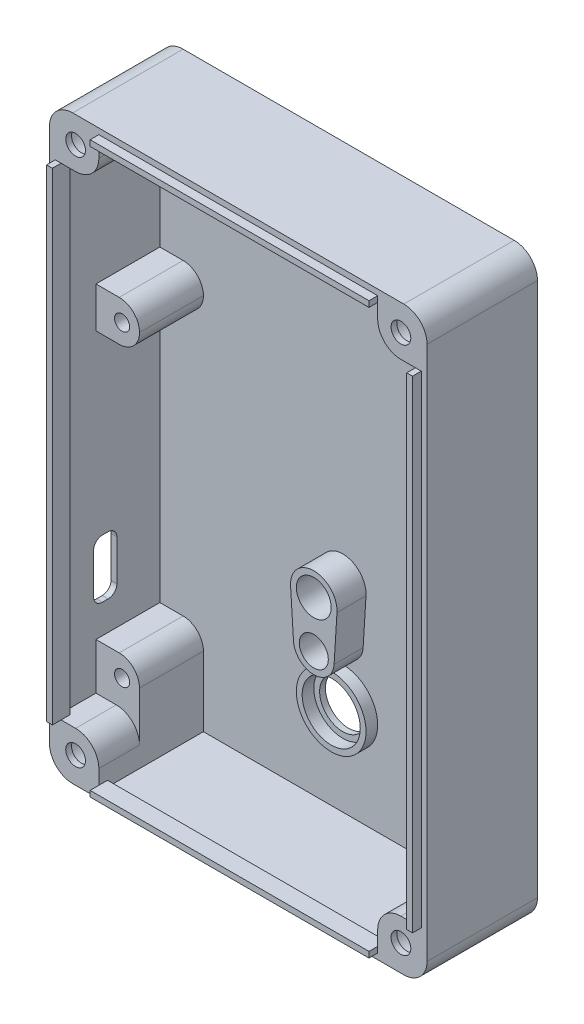
from build123d import *

# Parameters (mm, degrees)
SKETCH_1_W            = 65
SKETCH_1_H            = 100
SKETCH_1_W_2          = 63
SKETCH_1_H_2          = 98
EXTRUDE_1_DEPTH       = 18
SKETCH_3_W            = 65
SKETCH_3_H            = 100
EXTRUDE_2_DEPTH       = 1
SKETCH_4_W            = 7.5
SKETCH_4_H            = 7
SKETCH_4_H_2          = 8
EXTRUDE_3_DEPTH       = 11
SKETCH_8_W            = 7.5
SKETCH_8_H            = 7.5
EXTRUDE_4_DEPTH       = 18
EXTRUDE_10_DEPTH      = 1.5
EXTRUDE_10_DEPTH_BACK = 1.5
SKETCH_17_W           = 48
SKETCH_17_H           = 1
SKETCH_17_W_2         = 1
SKETCH_17_H_2         = 83
SKETCH_11_R           = 3
CUT_EXTRUDE_2_DEPTH   = 18
HOLE_WIZARD_M31_D     = 3.4
SKETCH_5_R            = 1.3
CUT_EXTRUDE_4_DEPTH   = 5
SKETCH_15_W           = 4
SKETCH_15_H           = 10
CUT_EXTRUDE_3_DEPTH   = 1
FILLET_5_R            = 1.5
FILLET_6_R            = 3.5
FILLET_7_R            = 4
SKETCH_16_R           = 6
SKETCH_16_R_2         = 5
EXTRUDE_6_DEPTH       = 2
SKETCH_10_6_R         = 3
SKETCH_10_6_R_2       = 2.5
EXTRUDE_8_DEPTH       = 5
SKETCH_9_4_R          = 4
SKETCH_9_4_R_2        = 2.5
SKETCH_9_4_R_3        = 3
CUT_EXTRUDE_6_DEPTH   = 63.741533293
FILLET_8_R            = 4


with BuildPart() as part:
    # Эскиз1 → Бобышка-Вытянуть1 (new body)
    with BuildSketch(Plane.XY):
        Rectangle(SKETCH_1_W, SKETCH_1_H)
        Rectangle(SKETCH_1_W_2, SKETCH_1_H_2, mode=Mode.SUBTRACT)
    extrude(amount=EXTRUDE_1_DEPTH)

    # Эскиз3 → Бобышка-Вытянуть2 (add)
    with BuildSketch(Plane(origin=(0, 0, 0), x_dir=(-1, 0, 0), z_dir=(0, 0, -1))):
        Rectangle(SKETCH_3_W, SKETCH_3_H)
    extrude(amount=EXTRUDE_2_DEPTH)

    # Эскиз4 → Бобышка-Вытянуть3 (add)
    with BuildSketch(Plane.XY):
        with Locations((-27.75, 16)):
            Rectangle(SKETCH_4_W, SKETCH_4_H)
        with Locations((27.75, 16)):
            Rectangle(SKETCH_4_W, SKETCH_4_H)
        with Locations((-27.75, -37.5)):
            Rectangle(SKETCH_4_W, SKETCH_4_H_2)
        with Locations((27.75, -37.5)):
            Rectangle(SKETCH_4_W, SKETCH_4_H_2)
    extrude(amount=EXTRUDE_3_DEPTH)

    # Эскиз8 → Бобышка-Вытянуть4 (add)
    with BuildSketch(Plane.XY):
        with Locations((-27.75, 45.25)):
            Rectangle(SKETCH_8_W, SKETCH_8_H)
        with Locations((27.75, 45.25)):
            Rectangle(SKETCH_8_W, SKETCH_8_H)
        with Locations((27.75, -45.25)):
            Rectangle(SKETCH_8_W, SKETCH_8_H)
        with Locations((-27.75, -45.25)):
            Rectangle(SKETCH_8_W, SKETCH_8_H)
    extrude(amount=EXTRUDE_4_DEPTH)

    # Эскиз17 → Бобышка-Вытянуть10 (add, two sides: drawn at the far end of the back side and taken through both)
    with BuildSketch(Plane.XY.offset(18).offset(-EXTRUDE_10_DEPTH_BACK)):
        with Locations((0, 48.5)):
            Rectangle(SKETCH_17_W, SKETCH_17_H)
        with Locations((31, 0)):
            Rectangle(SKETCH_17_W_2, SKETCH_17_H_2)
        with Locations((-31, 0)):
            Rectangle(SKETCH_17_W_2, SKETCH_17_H_2)
        with Locations((0, -48.5)):
            Rectangle(SKETCH_17_W, SKETCH_17_H)
    extrude(amount=EXTRUDE_10_DEPTH + EXTRUDE_10_DEPTH_BACK)

    # Эскиз11 → Вырез-Вытянуть2 (cut)
    with BuildSketch(Plane(origin=(0, 0, -1), x_dir=(-1, 0, 0), z_dir=(0, 0, -1))):
        with Locations((-28, 45.5)):
            Circle(SKETCH_11_R)
        with Locations((28, 45.5)):
            Circle(SKETCH_11_R)
        with Locations((28, -45.5)):
            Circle(SKETCH_11_R)
        with Locations((-28, -45.5)):
            Circle(SKETCH_11_R)
    extrude(amount=-CUT_EXTRUDE_2_DEPTH, mode=Mode.SUBTRACT)

    # Отверстие с зазором M31 (through all)
    with Locations(Plane(origin=(0, 0, 17), x_dir=(-1, 0, 0), z_dir=(0, 0, -1))):
        with Locations((-28, 45.5), (28, 45.5), (28, -45.5), (-28, -45.5)):
            Hole(HOLE_WIZARD_M31_D / 2)

    # Эскиз5 → Вырез-Вытянуть4 (cut)
    with BuildSketch(Plane.XY.offset(11)):
        with Locations((-27, 16)):
            Circle(SKETCH_5_R)
        with Locations((27, 16)):
            Circle(SKETCH_5_R)
        with Locations((-27, -37)):
            Circle(SKETCH_5_R)
        with Locations((27, -37)):
            Circle(SKETCH_5_R)
    extrude(amount=-CUT_EXTRUDE_4_DEPTH, mode=Mode.SUBTRACT)

    # Эскиз15 → Вырез-Вытянуть3 (cut)
    with BuildSketch(Plane.ZY.offset(31.5)):
        with Locations((9.4, -23.5)):
            Rectangle(SKETCH_15_W, SKETCH_15_H)
    extrude(amount=CUT_EXTRUDE_3_DEPTH, mode=Mode.SUBTRACT)

    # Скругление5
    fillet_5_edges = [part.edges().sort_by_distance(p)[0] for p in [
        (-32, -18.5, 11.4),
        (-32, -28.5, 11.4),
        (-32, -28.5, 7.4),
        (-32, -18.5, 7.4),
    ]]
    fillet(fillet_5_edges, radius=FILLET_5_R)

    # Скругление6
    fillet_6_edges = [part.edges().sort_by_distance(p)[0] for p in [
        (-24, 12.5, 5.5),
        (-24, 19.5, 5.5),
        (24, 19.5, 5.5),
        (24, 12.5, 5.5),
        (-24, -33.5, 5.5),
        (24, -33.5, 5.5),
    ]]
    fillet(fillet_6_edges, radius=FILLET_6_R - 0.0001)  # a hair under: the kernel refuses the full size

    # Скругление7
    fillet_7_edges = [part.edges().sort_by_distance(p)[0] for p in [
        (-24, 41.5, 9),
        (24, 41.5, 9),
        (24, -41.5, 14.5),
        (-24, -41.5, 14.5),
    ]]
    fillet(fillet_7_edges, radius=FILLET_7_R)

    # Эскиз16 → Бобышка-Вытянуть6 (add)
    with BuildSketch(Plane.XY):
        with Locations(Location((0, -33, 0), (0, 0, 180))):
            Circle(SKETCH_16_R)
        with Locations((0, -33)):
            Circle(SKETCH_16_R_2, mode=Mode.SUBTRACT)
    extrude(amount=EXTRUDE_6_DEPTH)

    # Эскиз10<6> → Бобышка-Вытянуть8 (add)
    # profile 1 of 3: a face of its own
    with BuildSketch(Plane.XY):
        with BuildLine():
            ThreePointArc((-3.992179856, -14.75), (0, -18.5), (3.992179856, -14.75))
            ThreePointArc((3.992179856, -14.75), (3.998044486, -14.62506114), (4, -14.5))
            ThreePointArc((4, -14.5), (-0.12506114, -10.501955514), (-3.992179856, -14.75))
        make_face()
        with Locations((0, -14.5)):
            Circle(SKETCH_10_6_R, mode=Mode.SUBTRACT)
    # profile 2 of 3: a face of its own
    with BuildSketch(Plane.XY):
        with BuildLine():
            Line((3.493157374, -22.71875), (3.992179856, -14.75))
            ThreePointArc((3.992179856, -14.75), (0, -18.5), (-3.992179856, -14.75))
            Line((-3.992179856, -14.75), (-3.493157374, -22.71875))
            ThreePointArc((-3.493157374, -22.71875), (-0.109428497, -19.001711075), (3.5, -22.5))
            ThreePointArc((3.5, -22.5), (3.498288925, -22.609428497), (3.493157374, -22.71875))
        make_face()
    # profile 3 of 3: a face of its own
    with BuildSketch(Plane.XY):
        with BuildLine():
            ThreePointArc((-3.493157374, -22.71875), (0, -26), (3.493157374, -22.71875))
            ThreePointArc((3.493157374, -22.71875), (3.498288925, -22.609428497), (3.5, -22.5))
            ThreePointArc((3.5, -22.5), (-0.109428497, -19.001711075), (-3.493157374, -22.71875))
        make_face()
        with Locations((0, -22.5)):
            Circle(SKETCH_10_6_R_2, mode=Mode.SUBTRACT)
    extrude(amount=EXTRUDE_8_DEPTH)

    # Эскиз9<4> → Вырез-Вытянуть6 (cut, through all)
    with BuildSketch(Plane.XY):
        with Locations((0, -33)):
            Circle(SKETCH_9_4_R)
        with Locations((0, -22.5)):
            Circle(SKETCH_9_4_R_2)
        with Locations((0, -14.5)):
            Circle(SKETCH_9_4_R_3)
    extrude(amount=-CUT_EXTRUDE_6_DEPTH, mode=Mode.SUBTRACT)

    # Скругление8
    fillet_8_edges = [part.edges().sort_by_distance(p)[0] for p in [
        (32.5, -50, 8.5),
        (-32.5, -50, 8.5),
        (-32.5, 50, 8.5),
        (32.5, 50, 8.5),
    ]]
    fillet(fillet_8_edges, radius=FILLET_8_R)


solid = part.part
